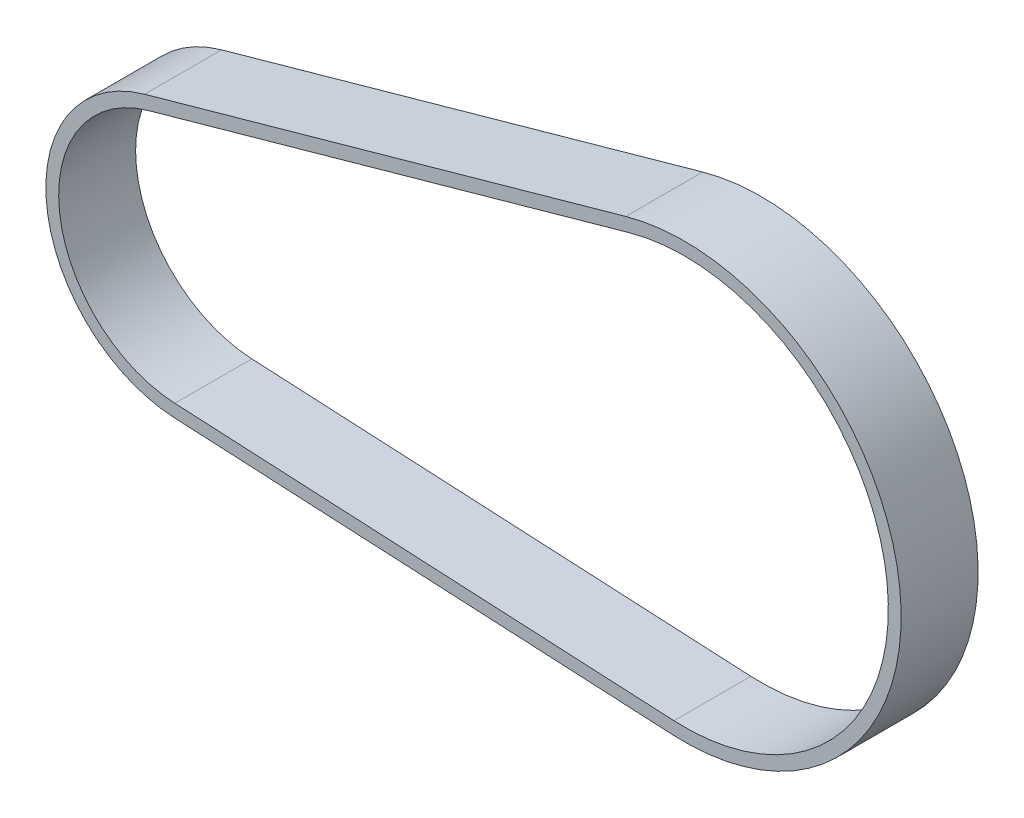
from build123d import *

# Parameters (mm, degrees)
EXTRUDE_THIN1_DEPTH = 9


with BuildPart() as part:
    # Sketch2 → Extrude-Thin1 (new body)
    with BuildSketch(Plane.XY):
        with BuildLine():
            Line((-4.267515495, 15.237635742), (52.020293802, 31.001833181))
            ThreePointArc((52.020293802, 31.001833181), (84.079847452, 9.382733921), (57.574688029, -18.771785379))
            Line((57.574688029, -18.771785379), (-0.803534427, -15.80353011))
            ThreePointArc((-0.803534427, -15.80353011), (-15.726327645, -1.754950233), (-4.267515495, 15.237635742))
        make_face()
        with BuildLine():
            Line((-3.862984685, 13.793213774), (52.424824613, 29.557411213))
            ThreePointArc((52.424824613, 29.557411213), (82.589100887, 9.216376836), (57.650857508, -17.273720557))
            Line((57.650857508, -17.273720557), (-0.727364948, -14.305465288))
            ThreePointArc((-0.727364948, -14.305465288), (-14.23558108, -1.588593147), (-3.862984685, 13.793213774))
        make_face(mode=Mode.SUBTRACT)
    extrude(amount=-EXTRUDE_THIN1_DEPTH)


solid = part.part
